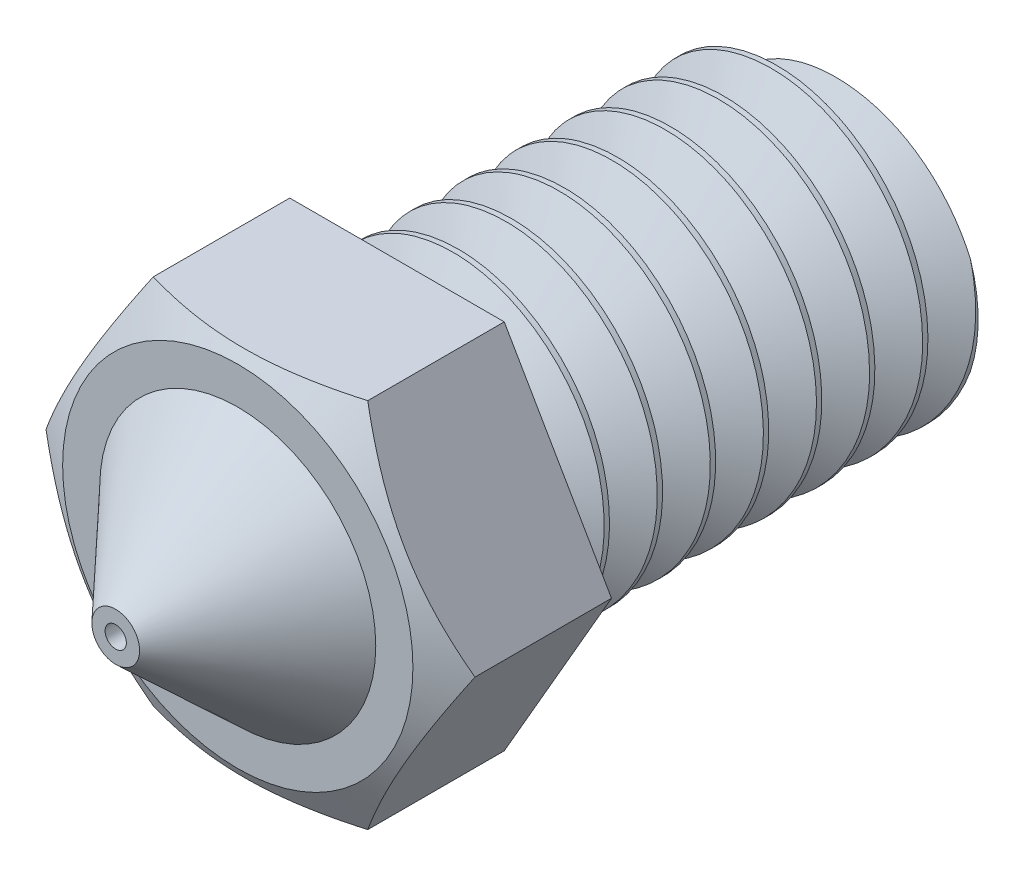
from build123d import *

# Parameters (mm, degrees)
SKETCH1_R           = 2.95
SKETCH1_R_2         = 0.875
BOSS_EXTRUDE1_DEPTH = 8
SKETCH2_R           = 0.875
BOSS_EXTRUDE2_DEPTH = 3
SKETCH3_R           = 2.6
BOSS_EXTRUDE3_DEPTH = 2.3
CHAMFER1_SIZE2      = 2.15
CHAMFER1_SIZE       = 2.3
SKETCH4_R           = 0.2
CUT_EXTRUDE1_DEPTH  = 17.3
CUT_SWEEP1_PITCH    = 1
CUT_SWEEP1_TO       = 13


with BuildPart() as part:
    # Sketch1 → Boss-Extrude1 (new body)
    with BuildSketch(Plane.XY):
        Circle(SKETCH1_R)
        Circle(SKETCH1_R_2, mode=Mode.SUBTRACT)
    extrude(amount=BOSS_EXTRUDE1_DEPTH)

    # Sketch2 → Boss-Extrude2 (add)
    with BuildSketch(Plane.XY.offset(8)):
        Polygon((4.041451884, 0), (2.020725942, 3.5), (-2.020725942, 3.5), (-4.041451884, 0), (-2.020725942, -3.5), (2.020725942, -3.5), align=None)
        Circle(SKETCH2_R, mode=Mode.SUBTRACT)
    extrude(amount=BOSS_EXTRUDE2_DEPTH)

    # Sketch3 → Boss-Extrude3 (add)
    with BuildSketch(Plane.XY.offset(11)):
        Circle(SKETCH3_R)
    extrude(amount=BOSS_EXTRUDE3_DEPTH)

    # Chamfer1
    chamfer1_edges = [part.edges().sort_by_distance(p)[0] for p in [
        (-2.6, 0, 13.3),
    ]]
    chamfer1_side = [part.faces().sort_by_distance(p)[0] for p in [
        (-2.6, 0, 13.257),
    ]]
    chamfer(chamfer1_edges, length=CHAMFER1_SIZE - 0.0001, length2=CHAMFER1_SIZE2 - 0.0001, reference=chamfer1_side[0])  # a hair under: the kernel refuses the full size

    # Sketch4 → Cut-Extrude1 (cut)
    with BuildSketch(Plane.XY.offset(13.3)):
        Circle(SKETCH4_R)
    extrude(amount=-CUT_EXTRUDE1_DEPTH, mode=Mode.SUBTRACT)

    # Sketch9 → Cut-Revolve1 (revolve, cut)
    with BuildSketch(Plane(origin=(0, 0, 0), x_dir=(0, 0, -1), z_dir=(1, 0, 0)), mode=Mode.PRIVATE) as cut_revolve1_sk:
        Polygon((-11, 3.3), (-10.422649731, 4.3), (-11, 4.3), align=None)
    revolve(cut_revolve1_sk.sketch.rotate(Axis((0, 0, 17.2791805), (0, 0, -1)), 270), axis=Axis((0, 0, 17.2791805), (0, 0, -1)), mode=Mode.SUBTRACT)

    # Cut-Sweep1: arcs per turn and ends read off the stored shape
    # Cut-Sweep1: the profile of Sketch10 profile screwed along a left-hand helix through 13.5 turns, 8 arcs to a turn; built about Z, then put on its axis
    cut_sweep1_z = Axis((0, 0, 0), (0, 0, 1))
    cut_sweep1_corners = [(2.9503, 0, -0.450173205), (2.9503, 0, 0.450173205), (2.170577137, 0, 0)]
    with BuildLine(mode=Mode.PRIVATE) as cut_sweep1_profile:
        Line(cut_sweep1_corners[0], cut_sweep1_corners[1])
        Line(cut_sweep1_corners[1], cut_sweep1_corners[2])
        Line(cut_sweep1_corners[2], cut_sweep1_corners[0])
    cut_sweep1_cap = Face(cut_sweep1_profile.wire())
    cut_sweep1_turn_angles = [0, -22.5, -45, -67.5, -90, -112.5, -135, -157.5, -180, -202.5, -225, -247.5, -270, -292.5, -315, -337.5, -360]
    cut_sweep1_turn_weights = [1, 0.9238795325112867, 1, 0.9238795325112867, 1, 0.9238795325112867, 1, 0.9238795325112867, 1, 0.9238795325112867, 1, 0.9238795325112867, 1, 0.9238795325112867, 1, 0.9238795325112867, 1]
    cut_sweep1_turn_rails = [Edge.make_bspline([Vector(p[0], p[1], 0).rotate(cut_sweep1_z, cut_sweep1_turn_angles[k]) / cut_sweep1_turn_weights[k] + Vector(0, 0, p[2] + -CUT_SWEEP1_PITCH * cut_sweep1_turn_angles[k] / 360) for k in range(17)], [0, 0, 0, 1, 1, 2, 2, 3, 3, 4, 4, 5, 5, 6, 6, 7, 7, 8, 8, 8], 2, cut_sweep1_turn_weights) for p in cut_sweep1_corners]
    cut_sweep1_turn_sides = [Face.make_surface_from_curves(cut_sweep1_turn_rails[p[0]], cut_sweep1_turn_rails[p[1]]) for p in [(0, 1), (1, 2), (2, 0)]]
    cut_sweep1_last_angles = [-4680, -4702.5, -4725, -4747.5, -4770, -4792.5, -4815, -4837.5, -4860]
    cut_sweep1_last_weights = [1, 0.9238795325112867, 1, 0.9238795325112867, 1, 0.9238795325112867, 1, 0.9238795325112867, 1]
    cut_sweep1_last_rails = [Edge.make_bspline([Vector(p[0], p[1], 0).rotate(cut_sweep1_z, cut_sweep1_last_angles[k]) / cut_sweep1_last_weights[k] + Vector(0, 0, p[2] + -CUT_SWEEP1_PITCH * cut_sweep1_last_angles[k] / 360) for k in range(9)], [0, 0, 0, 1, 1, 2, 2, 3, 3, 4, 4, 4], 2, cut_sweep1_last_weights) for p in cut_sweep1_corners]
    cut_sweep1_last_sides = [Face.make_surface_from_curves(cut_sweep1_last_rails[p[0]], cut_sweep1_last_rails[p[1]]) for p in [(0, 1), (1, 2), (2, 0)]]
    cut_sweep1 = Plane(origin=(0, 0, -5), x_dir=(-1, 0, 0), z_dir=(0, 0, 1)) * split(Solid(Shell([*[p.moved(Location((0, 0, CUT_SWEEP1_PITCH * i))) for i in range(13) for p in cut_sweep1_turn_sides], *cut_sweep1_last_sides, cut_sweep1_cap, cut_sweep1_cap.rotate(cut_sweep1_z, -4860).moved(Location((0, 0, -CUT_SWEEP1_PITCH * -4860 / 360)))])), bisect_by=Plane.XY.offset(CUT_SWEEP1_TO), keep=Keep.BOTTOM, mode=Mode.PRIVATE)
    add(cut_sweep1, mode=Mode.SUBTRACT)


solid = part.part
